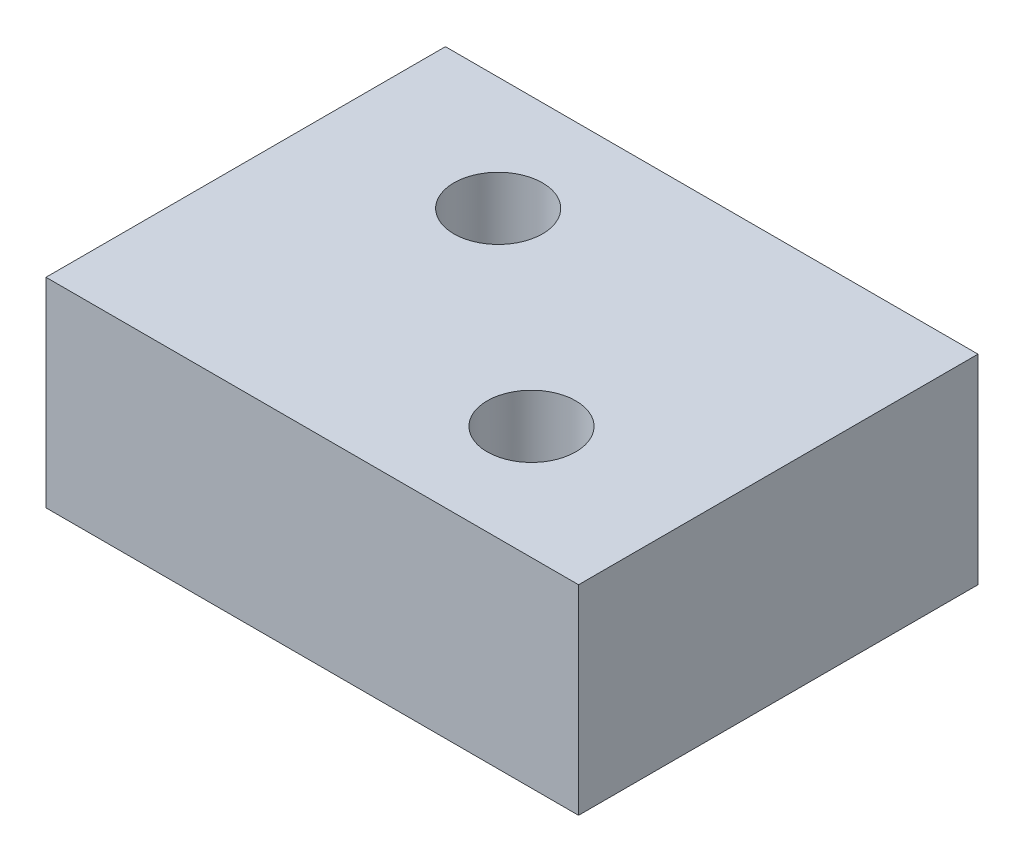
from build123d import *

# Parameters (mm, degrees)
SKETCH2_W               = 40
SKETCH2_H               = 30
BOSS_EXTRUDE1_DEPTH     = 10
SKETCH3_R               = 2
CUT_EXTRUDE1_DEPTH      = 5
SKETCH4_R               = 4.8125
CUT_EXTRUDE2_DEPTH      = 4
SKETCH8_W               = 40
SKETCH8_H               = 30
BOSS_EXTRUDE2_DEPTH     = 5
CUT_EXTRUDE3_DEPTH      = 27.570660511
CUT_EXTRUDE3_DEPTH_BACK = 1
SKETCH7_R               = 3.325


with BuildPart() as part:
    # Sketch2 → Boss-Extrude1 (new body)
    with BuildSketch(Plane(origin=(0, 0, 0), x_dir=(1, 0, 0), z_dir=(0, 1, 0))):
        Rectangle(SKETCH2_W, SKETCH2_H)
    extrude(amount=BOSS_EXTRUDE1_DEPTH)

    # Sketch3 → Cut-Extrude1 (cut)
    with BuildSketch(Plane(origin=(0, 0, 0), x_dir=(-1, 0, 0), z_dir=(0, -1, 0))):
        with Locations((-13.333333333, -10)):
            Circle(SKETCH3_R)
        with Locations((13.333333333, -10)):
            Circle(SKETCH3_R)
        with Locations((-13.333333333, 10)):
            Circle(SKETCH3_R)
        with Locations((13.333333333, 10)):
            Circle(SKETCH3_R)
    extrude(amount=-CUT_EXTRUDE1_DEPTH, mode=Mode.SUBTRACT)

    # Sketch4 → Cut-Extrude2 (cut)
    with BuildSketch(Plane(origin=(0, 10, 0), x_dir=(1, 0, 0), z_dir=(0, 1, 0))):
        with Locations((7.9286, -6.465)):
            Circle(SKETCH4_R)
        with Locations((-7.5, 6.4636)):
            Circle(SKETCH4_R)
    extrude(amount=-CUT_EXTRUDE2_DEPTH, mode=Mode.SUBTRACT)

    # Sketch8 → Boss-Extrude2 (add)
    with BuildSketch(Plane(origin=(0, 10, 0), x_dir=(1, 0, 0), z_dir=(0, 1, 0))):
        Rectangle(SKETCH8_W, SKETCH8_H)
    extrude(amount=BOSS_EXTRUDE2_DEPTH)

    # Sketch7 → Cut-Extrude3 (cut, two sides: drawn at the far end of the back side and taken through both)
    with BuildSketch(Plane(origin=(0, 6, 0), x_dir=(1, 0, 0), z_dir=(0, 1, 0)).offset(-CUT_EXTRUDE3_DEPTH_BACK)):
        with Locations((7.9286, -6.465)):
            Circle(SKETCH7_R)
        with Locations((-7.5, 6.4636)):
            Circle(SKETCH7_R)
    extrude(amount=CUT_EXTRUDE3_DEPTH + CUT_EXTRUDE3_DEPTH_BACK, mode=Mode.SUBTRACT)


solid = part.part
